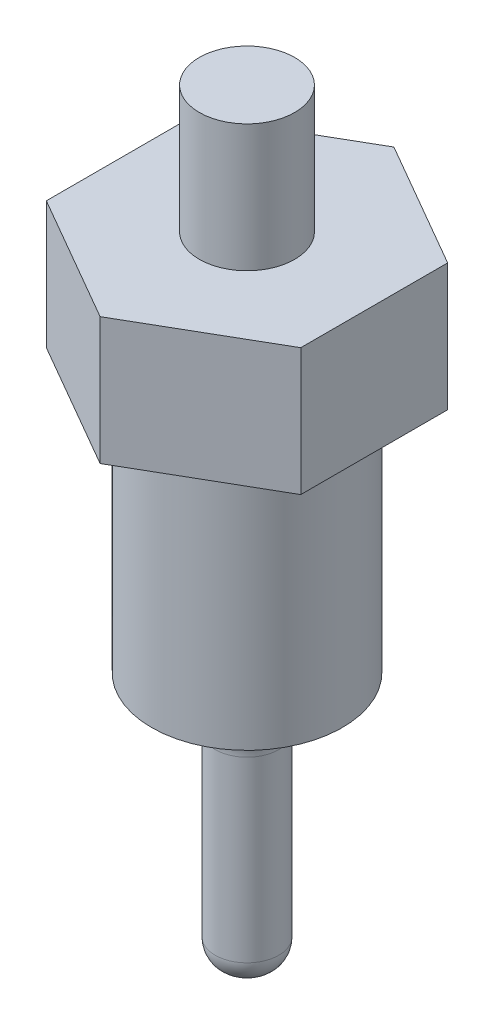
from build123d import *

# Parameters (mm, degrees)
SKETCH2_OUTSIDE_W  = 37.872
SKETCH2_OUTSIDE_H  = 37.872
CUT_EXTRUDE1_DEPTH = 43.121134838
FILLET1_R          = 2.54
FILLET2_R          = 1.27


with BuildPart() as part:
    # Sketch1 → Revolve1 (revolve)
    with BuildSketch(Plane.XY):
        Polygon((0, 0), (0, 38.1), (2.38125, 38.1), (2.38125, 31.75), (12.7, 31.75), (12.7, 25.4), (4.7625, 25.4), (4.7625, 12.7), (1.5875, 12.7), (1.5875, 0), align=None)
    revolve(axis=Axis((0, 0, 0), (0, -1, 0)))

    # Sketch2 outside → Cut-Extrude1 (cut, through all)
    with BuildSketch(Plane(origin=(0, 0, 0), x_dir=(1, 0, 0), z_dir=(0, 1, 0))):
        Rectangle(SKETCH2_OUTSIDE_W, SKETCH2_OUTSIDE_H)
        Polygon((6.35, 3.666174209), (0, 7.332348419), (-6.35, 3.666174209), (-6.35, -3.666174209), (0, -7.332348419), (6.35, -3.666174209), align=None, mode=Mode.SUBTRACT)
    extrude(amount=CUT_EXTRUDE1_DEPTH, mode=Mode.SUBTRACT)

    # Fillet1
    fillet1_edges = [part.edges().sort_by_distance(p)[0] for p in [
        (-1.5875, 12.7, 0),
    ]]
    fillet(fillet1_edges, radius=FILLET1_R)

    # Fillet2
    fillet2_edges = [part.edges().sort_by_distance(p)[0] for p in [
        (-1.5875, 0, 0),
    ]]
    fillet(fillet2_edges, radius=FILLET2_R)


solid = part.part
